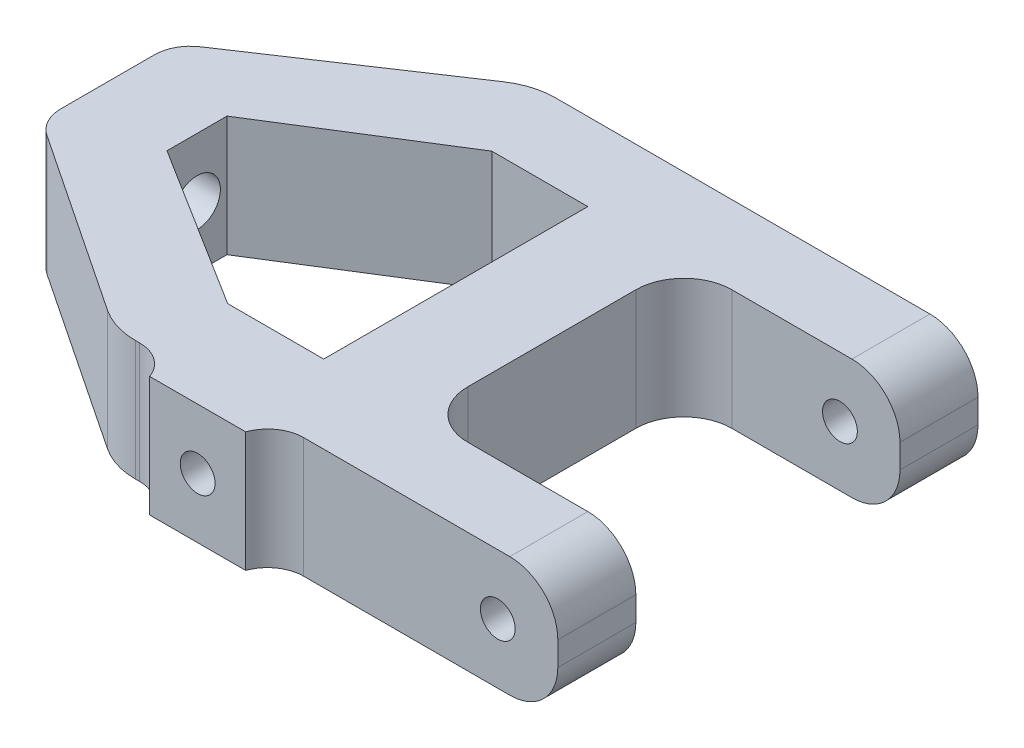
from build123d import *

# Parameters (mm, degrees)
SKETCH1_W           = 55
SKETCH1_H           = 35
BOSS_EXTRUDE1_DEPTH = 10
SKETCH2_W           = 22
SKETCH2_H           = 10
CUT_EXTRUDE1_DEPTH  = 34
CUT_EXTRUDE6_DEPTH  = 66.954529791
CUT_EXTRUDE7_DEPTH  = 66.954529791
SKETCH11_W          = 8
SKETCH11_H          = 22
BOSS_EXTRUDE3_DEPTH = 10
SKETCH12_R          = 1.45
CUT_EXTRUDE8_DEPTH  = 66.954529791
SKETCH13_R          = 1.95
CUT_EXTRUDE9_DEPTH  = 11
FILLET4_R           = 4
FILLET5_R           = 3
FILLET6_R           = 6
FILLET7_R           = 4
SKETCH14_W          = 8
SKETCH14_H          = 10
BOSS_EXTRUDE4_DEPTH = 2
SKETCH15_R          = 1.45
CUT_EXTRUDE10_DEPTH = 12
FILLET8_R           = 3


with BuildPart() as part:
    # Sketch1 → Boss-Extrude1 (new body)
    with BuildSketch(Plane(origin=(0, 0, 0), x_dir=(1, 0, 0), z_dir=(0, 1, 0))):
        with Locations((27.5, -17.5)):
            Rectangle(SKETCH1_W, SKETCH1_H)
    extrude(amount=BOSS_EXTRUDE1_DEPTH)

    # Sketch2 → Cut-Extrude1 (cut)
    with BuildSketch(Plane(origin=(55, 0, 0), x_dir=(0, 0, -1), z_dir=(1, 0, 0))):
        with Locations((-17.5, 5)):
            Rectangle(SKETCH2_W, SKETCH2_H)
    extrude(amount=-CUT_EXTRUDE1_DEPTH, mode=Mode.SUBTRACT)

    # Sketch9 → Cut-Extrude6 (cut, through all)
    with BuildSketch(Plane(origin=(0, 0, 0), x_dir=(-1, 0, 0), z_dir=(0, -1, 0))):
        Polygon((0, -12), (-18, 0), (0, 0), align=None)
        Polygon((0, -23), (-18, -35), (0, -35), align=None)
    extrude(amount=-CUT_EXTRUDE6_DEPTH, mode=Mode.SUBTRACT)

    # Sketch10 → Cut-Extrude7 (cut, through all)
    with BuildSketch(Plane(origin=(0, 0, 0), x_dir=(-1, 0, 0), z_dir=(0, -1, 0))):
        Polygon((-21, -6.5), (-7.444558288, -15), (-7.444558288, -20), (-21, -28.5), align=None)
    extrude(amount=-CUT_EXTRUDE7_DEPTH, mode=Mode.SUBTRACT)

    # Sketch11 → Boss-Extrude3 (add)
    with BuildSketch(Plane(origin=(0, 0, 0), x_dir=(-1, 0, 0), z_dir=(0, -1, 0))):
        with Locations((-33, -17.5)):
            Rectangle(SKETCH11_W, SKETCH11_H)
    extrude(amount=-BOSS_EXTRUDE3_DEPTH)

    # Sketch12 → Cut-Extrude8 (cut, through all)
    with BuildSketch(Plane.XY.offset(35)):
        with Locations((50, 5)):
            Circle(SKETCH12_R)
    extrude(amount=-CUT_EXTRUDE8_DEPTH, mode=Mode.SUBTRACT)

    # Sketch13 → Cut-Extrude9 (cut)
    with BuildSketch(Plane.ZY):
        with Locations((17.5, 5)):
            Circle(SKETCH13_R)
    extrude(amount=-CUT_EXTRUDE9_DEPTH, mode=Mode.SUBTRACT)

    # Fillet4
    fillet4_edges = [part.edges().sort_by_distance(p)[0] for p in [
        (55, 10, 31.75),
        (55, 0, 3.25),
        (55, 10, 3.25),
        (55, 0, 31.75),
    ]]
    fillet(fillet4_edges, radius=FILLET4_R)

    # Fillet5
    fillet5_edges = [part.edges().sort_by_distance(p)[0] for p in [
        (0, 5, 12),
        (0, 5, 23),
    ]]
    fillet(fillet5_edges, radius=FILLET5_R)

    # Fillet6
    fillet6_edges = [part.edges().sort_by_distance(p)[0] for p in [
        (18, 5, 0),
        (18, 5, 35),
    ]]
    fillet(fillet6_edges, radius=FILLET6_R)

    # Fillet7
    fillet7_edges = [part.edges().sort_by_distance(p)[0] for p in [
        (37, 5, 28.5),
        (37, 5, 6.5),
    ]]
    fillet(fillet7_edges, radius=FILLET7_R)

    # Sketch14 → Boss-Extrude4 (add)
    with BuildSketch(Plane.XY.offset(35)):
        with Locations((27, 5)):
            Rectangle(SKETCH14_W, SKETCH14_H)
    extrude(amount=BOSS_EXTRUDE4_DEPTH)

    # Sketch15 → Cut-Extrude10 (cut)
    with BuildSketch(Plane.XY.offset(37)):
        with Locations((27, 5)):
            Circle(SKETCH15_R)
    extrude(amount=-CUT_EXTRUDE10_DEPTH, mode=Mode.SUBTRACT)

    # Fillet8
    # the kernel refuses this fillet: 3 mm, written as the material it adds along each edge
    with BuildSketch(Plane(origin=(23, 0, 35), x_dir=(0, 0, 1), z_dir=(0, 1, 0))) as fillet8_piece_1:
        with BuildLine():
            CenterArc((3, -2.828427125), FILLET8_R, 109.471220634, 70.528779366)
            Line((0, -2.828427125), (-0.06, -2.828427125))
            Line((-0.06, -2.828427125), (-0.06, 0))
            Line((-0.06, 0), (0, 0.06))
            ThreePointArc((0, 0.06), (1, 0.06), (1.98, 0.056568542))
            Line((1.98, 0.056568542), (2, 0))
        make_face()
    extrude(amount=10)
    with BuildSketch(Plane(origin=(31, 10, 35), x_dir=(1, 0, 0), z_dir=(0, -1, 0))) as fillet8_piece_2:
        with BuildLine():
            CenterArc((2.828427125, 3), FILLET8_R, 199.471220634, 70.528779366)
            Line((0, 2), (-0.056568542, 1.98))
            ThreePointArc((-0.056568542, 1.98), (-0.06, 1), (-0.06, 0))
            Line((-0.06, 0), (0, -0.06))
            Line((0, -0.06), (2.828427125, -0.06))
            Line((2.828427125, -0.06), (2.828427125, 0))
        make_face()
    extrude(amount=10)


solid = part.part
